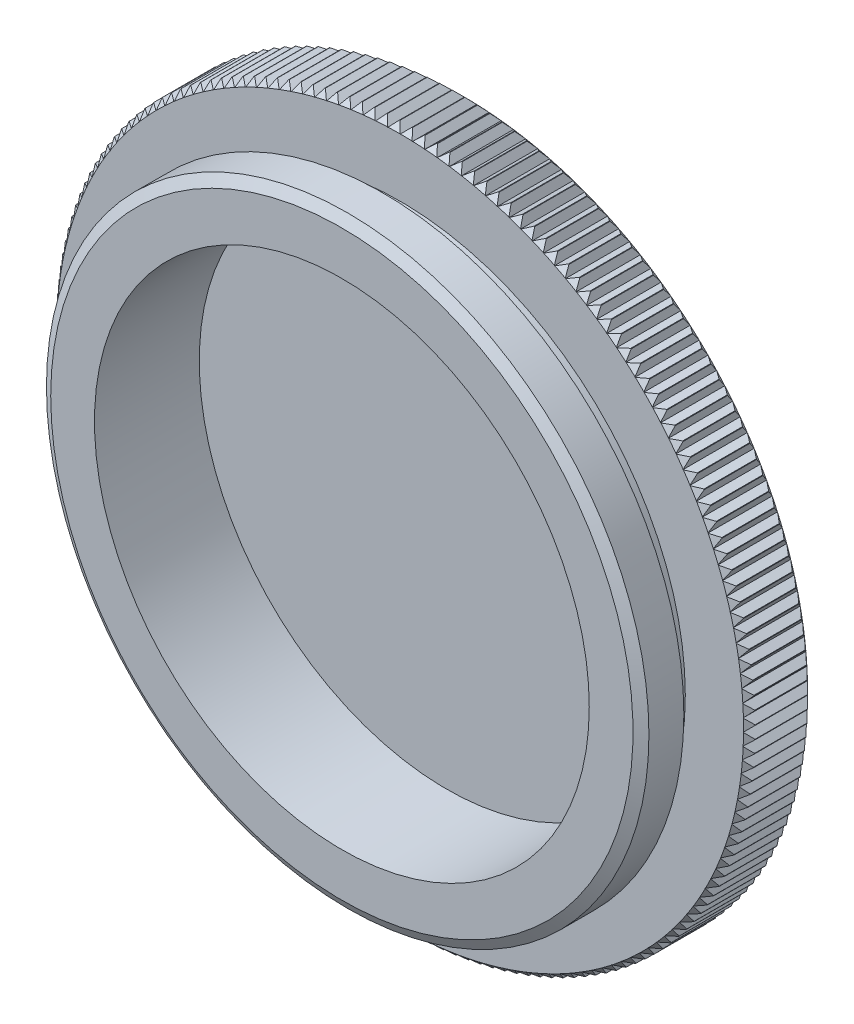
from build123d import *

# Parameters (mm, degrees)
SKETCH2_R          = 10.795
CUT_EXTRUDE1_DEPTH = 4.572
CHAMFER1_SIZE      = 0.254
CHAMFER1_SIZE2     = 0.439940905
CHAMFER2_SIZE      = 0.254
CUT_EXTRUDE2_REACH = 24.203
CIRPATTERN2_COUNT  = 175
CUT_EXTRUDE3_DEPTH = 0.0254
CUT_EXTRUDE4_DEPTH = 0.0254
CUT_EXTRUDE5_DEPTH = 0.0254
CIRPATTERN3_COUNT  = 4


with BuildPart() as part:
    # Sketch1 → Revolve1 (revolve)
    with BuildSketch(Plane(origin=(0, 0, 0), x_dir=(0, 0, -1), z_dir=(1, 0, 0))):
        Polygon((1.393778166, 0), (1.393778166, 15.24), (-1.400221834, 15.24), (-1.400221834, 12.446), (-2.162221834, 12.446), (-2.162221834, 13.1445), (-3.940221834, 13.1445), (-3.940221834, 0), align=None)
    revolve(axis=Axis((0, 0, 0), (0, 0, -1)))

    # Sketch2 → Cut-Extrude1 (cut)
    with BuildSketch(Plane.XY.offset(3.940221834)):
        Circle(SKETCH2_R)
    extrude(amount=-CUT_EXTRUDE1_DEPTH, mode=Mode.SUBTRACT)

    # Chamfer1
    chamfer1_edges = [part.edges().sort_by_distance(p)[0] for p in [
        (0, -13.1445, 3.940221834),
    ]]
    chamfer1_side = [part.faces().sort_by_distance(p)[0] for p in [
        (0, -13.1445, 3.051221834),
    ]]
    chamfer(chamfer1_edges, length=CHAMFER1_SIZE, length2=CHAMFER1_SIZE2, reference=chamfer1_side[0])

    # Chamfer2
    chamfer2_edges = [part.edges().sort_by_distance(p)[0] for p in [
        (0, -15.24, -1.393778166),
        (0, -15.24, 1.400221834),
    ]]
    chamfer(chamfer2_edges, length=CHAMFER2_SIZE)

    # Sketch3 → Cut-Extrude2 (cut, up to next)
    with BuildSketch(Plane(origin=(0, 0, -1.393778166), x_dir=(-1, 0, 0), z_dir=(0, 0, -1)), mode=Mode.PRIVATE) as cut_extrude2_sk1:
        Polygon((0, 14.9754082), (0.262333791, 15.237741991), (0.262333791, 15.352349649), (-0.262333791, 15.352349649), (-0.262333791, 15.237741991), align=None)
    cut_extrude2_tool1 = extrude(cut_extrude2_sk1.sketch, amount=-CUT_EXTRUDE2_REACH, mode=Mode.PRIVATE) & part.part
    cut_extrude2 = cut_extrude2_tool1.solids().sort_by_distance((0, 15.217795, -1.393778))[0]
    add(cut_extrude2, mode=Mode.SUBTRACT)

    # CirPattern2: Cut-Extrude2 ×175 about axis
    cirpattern2_axis = Axis((0, 0, 0), (0, 0, 1))
    for i in range(1, CIRPATTERN2_COUNT):
        add(cut_extrude2.rotate(cirpattern2_axis, i * 360 / CIRPATTERN2_COUNT), mode=Mode.SUBTRACT)

    # Sketch6 → Cut-Extrude3 (cut)
    # profile 1 of 6: a face of its own
    with BuildSketch(Plane(origin=(0, 0, -1.393778166), x_dir=(-1, 0, 0), z_dir=(0, 0, -1))):
        with BuildLine():
            Line((-5.425242444, -10.039358742), (-4.036280419, -10.672801384))
            Line((-4.036280419, -10.672801384), (-4.165591337, -10.95674284))
            add(Edge.make_bspline(
                [(-4.165591337, -10.95674284), (-4.232191946, -10.976236448), (-4.36567092, -11.015304963), (-4.564922799, -11.072620829), (-4.759755235, -11.131036019), (-4.88571104, -11.175820614), (-4.947334612, -11.197731368)],
                knots=[0, 0, 0, 0, 1.017738134, 2.039720695, 3.040938103, 4, 4, 4, 4], degree=3))
            add(Edge.make_bspline(
                [(-4.947334612, -11.197731368), (-4.977830028, -11.208746265), (-5.036913919, -11.230087273), (-5.121611793, -11.263230337), (-5.199955211, -11.294745642), (-5.271588448, -11.325274682), (-5.336157968, -11.355834587), (-5.394588197, -11.384462266), (-5.446237185, -11.412422199), (-5.491836119, -11.439979976), (-5.532955208, -11.467753435), (-5.570170089, -11.497999958), (-5.605111543, -11.52997129), (-5.637124262, -11.564435421), (-5.666763536, -11.600709247), (-5.693451524, -11.639291504), (-5.71751191, -11.679935178), (-5.731236872, -11.708389915), (-5.738120609, -11.722661352)],
                knots=[0, 0, 0, 0, 1.592887712, 3.086168888, 4.4680128, 5.741651633, 6.910933722, 7.977189631, 8.938048339, 9.795198854, 10.594116998, 11.373513348, 12.149031202, 12.919121943, 13.682347591, 14.448476952, 15.22183562, 16, 16, 16, 16], degree=3))
            add(Edge.make_bspline(
                [(-5.738120609, -11.722661352), (-5.743826863, -11.735819401), (-5.75492521, -11.761411076), (-5.76650659, -11.800600604), (-5.774595841, -11.838830739), (-5.777636836, -11.876633744), (-5.776818881, -11.913777521), (-5.771803627, -11.95018178), (-5.762719795, -11.985891737), (-5.749089275, -12.020598656), (-5.73133571, -12.054256421), (-5.709561712, -12.086322006), (-5.684076232, -12.11672224), (-5.654949122, -12.145452608), (-5.621586356, -12.172113086), (-5.584565864, -12.197365882), (-5.543665966, -12.220915888), (-5.514706241, -12.234959106), (-5.499844897, -12.242165704)],
                knots=[0, 0, 0, 0, 1.061588905, 2.064731641, 3.021634949, 3.951648557, 4.867479151, 5.769111024, 6.66818134, 7.590860501, 8.524820106, 9.481723414, 10.456695271, 11.459402951, 12.507400122, 13.616091355, 14.776642925, 16, 16, 16, 16], degree=3))
            add(Edge.make_bspline(
                [(-5.499844897, -12.242165704), (-5.478593151, -12.251307508), (-5.435124759, -12.270006184), (-5.36538503, -12.291034228), (-5.29123057, -12.309394166), (-5.212517736, -12.322782824), (-5.130334442, -12.33096062), (-5.045886698, -12.333019418), (-4.959564504, -12.329771645), (-4.901929254, -12.322340964), (-4.87273216, -12.3185767)],
                knots=[0, 0, 0, 0, 0.866926765, 1.77321487, 2.727288421, 3.730788597, 4.764442105, 5.821714027, 6.89651521, 8, 8, 8, 8], degree=3))
            Line((-4.87273216, -12.3185767), (-4.859168077, -12.324454469))
            Line((-4.859168077, -12.324454469), (-4.987122587, -12.605230973))
            add(Edge.make_bspline(
                [(-4.987122587, -12.605230973), (-5.008082524, -12.605043439), (-5.052792122, -12.604643411), (-5.123574194, -12.598270577), (-5.202115904, -12.587613334), (-5.286586956, -12.573300921), (-5.373213304, -12.553669686), (-5.458296088, -12.529888635), (-5.539882701, -12.5015493), (-5.592058243, -12.478952734), (-5.617852413, -12.467781606)],
                knots=[0, 0, 0, 0, 0.773842009, 1.650680822, 2.622056144, 3.700895976, 4.813535669, 5.900713834, 6.962169978, 8, 8, 8, 8], degree=3))
            add(Edge.make_bspline(
                [(-5.617852413, -12.467781606), (-5.643028605, -12.45573479), (-5.692205257, -12.432203746), (-5.76151723, -12.392553339), (-5.824144756, -12.34943173), (-5.880475661, -12.303709012), (-5.930575951, -12.255394394), (-5.973697483, -12.203782368), (-6.011306468, -12.149964079), (-6.041461712, -12.092890887), (-6.064907304, -12.034177969), (-6.082073986, -11.974403298), (-6.09154921, -11.913652993), (-6.093683161, -11.852062168), (-6.089199107, -11.789719297), (-6.077255836, -11.726668934), (-6.058046155, -11.662813663), (-6.040537909, -11.621085246), (-6.031556922, -11.59968034)],
                knots=[0, 0, 0, 0, 1.232694487, 2.407821973, 3.523267887, 4.588047798, 5.60974283, 6.59262967, 7.554800723, 8.504918084, 9.437114425, 10.343416046, 11.246459297, 12.145887458, 13.060441743, 14.001935556, 14.975077813, 16, 16, 16, 16], degree=3))
            add(Edge.make_bspline(
                [(-6.031556922, -11.59968034), (-6.02245499, -11.580719016), (-6.004525481, -11.543367909), (-5.973850275, -11.490253695), (-5.939477828, -11.441484192), (-5.903584564, -11.395298881), (-5.863575505, -11.353356507), (-5.821929725, -11.31323253), (-5.776183224, -11.276960417), (-5.743983462, -11.254960141), (-5.727721479, -11.243849248)],
                knots=[0, 0, 0, 0, 1.06380074, 2.095535857, 3.098010515, 4.080336405, 5.051264601, 6.027417132, 7.003778056, 8, 8, 8, 8], degree=3))
            add(Edge.make_bspline(
                [(-5.727721479, -11.243849248), (-5.695792847, -11.223983038), (-5.630594286, -11.183416053), (-5.542524327, -11.140972091), (-5.466844771, -11.108231981), (-5.404407639, -11.083205229), (-5.337586712, -11.056616761), (-5.29101215, -11.039943351), (-5.266994818, -11.031345292)],
                knots=[0, 0, 0, 0, 1.330236432, 2.716355056, 3.454655655, 4.249137999, 5.09712445, 6, 6, 6, 6], degree=3))
            add(Edge.make_bspline(
                [(-5.266994818, -11.031345292), (-5.195574938, -11.006271373), (-5.052719604, -10.956118068), (-4.872103984, -10.90119167), (-4.728838735, -10.859860919), (-4.624981332, -10.830075516), (-4.524807915, -10.801413224), (-4.459187876, -10.783088941), (-4.426925989, -10.774079865)],
                knots=[0, 0, 0, 0, 1.550264238, 3.100866531, 3.865829164, 4.604496434, 5.313905015, 6, 6, 6, 6], degree=3))
            Line((-4.426925989, -10.774079865), (-5.53059015, -10.270852413))
            Line((-5.53059015, -10.270852413), (-5.425242444, -10.039358742))
        make_face()
    # profile 2 of 6: a face of its own
    with BuildSketch(Plane(origin=(0, 0, -1.393778166), x_dir=(-1, 0, 0), z_dir=(0, 0, -1))):
        with BuildLine():
            add(Edge.make_bspline(
                [(-4.370808887, -12.254548448), (-4.363448548, -12.230565594), (-4.348935502, -12.183276437), (-4.319160875, -12.1160791), (-4.283795917, -12.053442039), (-4.243059217, -11.995424138), (-4.197471252, -11.94270888), (-4.147971805, -11.895279688), (-4.09442453, -11.853766963), (-4.055915652, -11.830675618), (-4.036680327, -11.819141407)],
                knots=[0, 0, 0, 0, 1.06803962, 2.105950047, 3.12378519, 4.12849274, 5.120937985, 6.08828592, 7.045091874, 8, 8, 8, 8], degree=3))
            add(Edge.make_bspline(
                [(-4.036680327, -11.819141407), (-4.011750512, -11.806417896), (-3.962091416, -11.78107322), (-3.883198959, -11.752217478), (-3.800931448, -11.733742539), (-3.714829313, -11.722265649), (-3.622917983, -11.721318831), (-3.523707929, -11.730513278), (-3.416280426, -11.748992758), (-3.342961697, -11.768640525), (-3.30467202, -11.778901296)],
                knots=[0, 0, 0, 0, 0.890553357, 1.773943134, 2.665465361, 3.570061211, 4.534577923, 5.584519364, 6.738549137, 8, 8, 8, 8], degree=3))
            Line((-3.30467202, -11.778901296), (-3.009427163, -11.86254647))
            Line((-3.009427163, -11.86254647), (-2.780194172, -11.052318622))
            Line((-2.780194172, -11.052318622), (-2.490827083, -11.134155252))
            Line((-2.490827083, -11.134155252), (-3.11341846, -13.333345125))
            Line((-3.11341846, -13.333345125), (-3.713403033, -13.163341961))
            add(Edge.make_bspline(
                [(-3.713403033, -13.163341961), (-3.745309003, -13.153872059), (-3.806562554, -13.135691603), (-3.893133657, -13.10429712), (-3.971179595, -13.071721245), (-4.040674363, -13.036133195), (-4.10326092, -12.997752731), (-4.15960695, -12.955588792), (-4.211414523, -12.910543602), (-4.241518778, -12.877008515), (-4.25641846, -12.86041079)],
                knots=[0, 0, 0, 0, 1.265266304, 2.429076906, 3.499871165, 4.478943139, 5.395005205, 6.287864705, 7.152602476, 8, 8, 8, 8], degree=3))
            add(Edge.make_bspline(
                [(-4.25641846, -12.86041079), (-4.272396475, -12.84009175), (-4.303882201, -12.800051749), (-4.342818231, -12.734833466), (-4.372064269, -12.665927823), (-4.394043987, -12.593801712), (-4.405571543, -12.516441112), (-4.404847173, -12.433716022), (-4.393965812, -12.34522989), (-4.378739521, -12.28560444), (-4.370808887, -12.254548448)],
                knots=[0, 0, 0, 0, 0.961022529, 1.893757851, 2.815508266, 3.739762077, 4.692092892, 5.712547857, 6.808577601, 8, 8, 8, 8], degree=3))
        make_face()
        with BuildLine():
            add(Edge.make_bspline(
                [(-4.079181118, -12.329150901), (-4.084036698, -12.347444057), (-4.093454943, -12.382926832), (-4.099232715, -12.436445719), (-4.100851996, -12.487555562), (-4.094798335, -12.536567451), (-4.082429156, -12.583033881), (-4.064292971, -12.627487392), (-4.039205145, -12.669512803), (-4.018053877, -12.69474825), (-4.007291482, -12.707588796)],
                knots=[0, 0, 0, 0, 1.123772775, 2.179753816, 3.192567675, 4.158504816, 5.104065234, 6.044345053, 7.004904602, 8, 8, 8, 8], degree=3))
            add(Edge.make_bspline(
                [(-4.007291482, -12.707588796), (-3.996764126, -12.718320293), (-3.975516332, -12.739980113), (-3.940043078, -12.769494715), (-3.900905422, -12.796006298), (-3.858188509, -12.821029714), (-3.809738537, -12.843642009), (-3.755239133, -12.865614348), (-3.693786673, -12.886916472), (-3.650311694, -12.89977884), (-3.627497178, -12.90652867)],
                knots=[0, 0, 0, 0, 0.83025547, 1.675738661, 2.544201566, 3.439709683, 4.408133241, 5.495201935, 6.685548445, 8, 8, 8, 8], degree=3))
            Line((-3.627497178, -12.90652867), (-3.329087368, -12.991078116))
            Line((-3.329087368, -12.991078116), (-3.083125343, -12.12297685))
            Line((-3.083125343, -12.12297685), (-3.337677954, -12.050635078))
            add(Edge.make_bspline(
                [(-3.337677954, -12.050635078), (-3.36683879, -12.042785746), (-3.422290693, -12.027859549), (-3.502591221, -12.011421801), (-3.575521404, -12.001159914), (-3.641638776, -11.99709054), (-3.702096594, -11.999820428), (-3.757851176, -12.008101288), (-3.809796719, -12.02293314), (-3.841527578, -12.037850045), (-3.857182305, -12.045209445)],
                knots=[0, 0, 0, 0, 1.362124689, 2.590200228, 3.695023736, 4.682388931, 5.574001468, 6.420206356, 7.220593491, 8, 8, 8, 8], degree=3))
            add(Edge.make_bspline(
                [(-3.857182305, -12.045209445), (-3.871826193, -12.053673533), (-3.90028374, -12.070121841), (-3.938867825, -12.098676886), (-3.972397547, -12.129769335), (-4.001076164, -12.163560821), (-4.025837531, -12.200094597), (-4.046434428, -12.24012585), (-4.065493197, -12.282885324), (-4.074551597, -12.313502984), (-4.079181118, -12.329150901)],
                knots=[0, 0, 0, 0, 1.092289841, 2.12265277, 3.094223843, 4.04067576, 4.980642125, 5.939043408, 6.946696852, 8, 8, 8, 8], degree=3))
        make_face(mode=Mode.SUBTRACT)
    # profile 3 of 6: a face of its own
    with BuildSketch(Plane(origin=(0, 0, -1.393778166), x_dir=(-1, 0, 0), z_dir=(0, 0, -1))):
        with BuildLine():
            add(Edge.make_bspline(
                [(-2.324092495, -11.329993519), (-2.296176793, -11.321660783), (-2.242956791, -11.305774805), (-2.177359132, -11.284606898), (-2.124995928, -11.268058021), (-2.081103155, -11.25719253), (-2.032202481, -11.245619184), (-1.997679134, -11.238980423), (-1.979564805, -11.235497079)],
                knots=[0, 0, 0, 0, 1.466561919, 2.795932913, 3.470355627, 4.230381201, 5.071484681, 6, 6, 6, 6], degree=3))
            add(Edge.make_bspline(
                [(-1.979564805, -11.235497079), (-1.946307553, -11.230156045), (-1.877476513, -11.219101948), (-1.78905805, -11.211044569), (-1.714335103, -11.207838357), (-1.65504583, -11.208468975), (-1.593314388, -11.211425762), (-1.55152427, -11.215983734), (-1.530141546, -11.218315908)],
                knots=[0, 0, 0, 0, 1.342800985, 2.779134778, 3.536914688, 4.324168581, 5.14252838, 6, 6, 6, 6], degree=3))
            add(Edge.make_bspline(
                [(-1.530141546, -11.218315908), (-1.489937103, -11.223838388), (-1.411216246, -11.23465148), (-1.297359082, -11.261669463), (-1.190188046, -11.296361986), (-1.089672714, -11.339346625), (-0.996177356, -11.390892649), (-0.910022376, -11.451246801), (-0.831832968, -11.521173082), (-0.786832262, -11.574488475), (-0.764223033, -11.601275165)],
                knots=[0, 0, 0, 0, 1.107115004, 2.167746567, 3.188899937, 4.178419171, 5.146903913, 6.097560798, 7.044177573, 8, 8, 8, 8], degree=3))
            add(Edge.make_bspline(
                [(-0.764223033, -11.601275165), (-0.743668705, -11.629629877), (-0.702002515, -11.68710842), (-0.65079115, -11.783029826), (-0.61011659, -11.888184774), (-0.583261042, -11.981487936), (-0.566365807, -12.060020407), (-0.557198199, -12.121833181), (-0.549705969, -12.18543142), (-0.54571854, -12.251239129), (-0.544963147, -12.318976165), (-0.546805022, -12.388651141), (-0.551269324, -12.460296778), (-0.556363124, -12.508577502), (-0.558953255, -12.533127617)],
                knots=[0, 0, 0, 0, 1.286889081, 2.608684938, 3.98483233, 5.426846736, 6.174771155, 6.937521092, 7.724066818, 8.529314638, 9.360803527, 10.214677469, 11.092186878, 12, 12, 12, 12], degree=3))
            add(Edge.make_bspline(
                [(-0.558953255, -12.533127617), (-0.565098545, -12.578932586), (-0.577114371, -12.668494587), (-0.607947653, -12.797357423), (-0.646391325, -12.918075947), (-0.694907361, -13.029383112), (-0.751471299, -13.131653301), (-0.815960754, -13.224507528), (-0.88809558, -13.308082896), (-0.942834257, -13.355862376), (-0.969944948, -13.379526351)],
                knots=[0, 0, 0, 0, 1.149088359, 2.246801099, 3.291406915, 4.297234375, 5.262297596, 6.194235069, 7.105650009, 8, 8, 8, 8], degree=3))
            add(Edge.make_bspline(
                [(-0.969944948, -13.379526351), (-0.9976768, -13.40054257), (-1.053193371, -13.442615072), (-1.145055016, -13.493889139), (-1.242784768, -13.536386424), (-1.346860208, -13.568282635), (-1.456422332, -13.58983335), (-1.570516768, -13.6016055), (-1.689231132, -13.602629386), (-1.769212264, -13.595011975), (-1.810013777, -13.591126035)],
                knots=[0, 0, 0, 0, 0.937282879, 1.876352493, 2.828321192, 3.806531764, 4.805160123, 5.834690619, 6.895390737, 8, 8, 8, 8], degree=3))
            add(Edge.make_bspline(
                [(-1.810013777, -13.591126035), (-1.840358393, -13.586928156), (-1.901186902, -13.578513132), (-1.99172583, -13.559994646), (-2.081437769, -13.535261098), (-2.171495511, -13.505398546), (-2.262956588, -13.46762977), (-2.357607823, -13.421737702), (-2.456203104, -13.366889735), (-2.522021356, -13.325441421), (-2.556038302, -13.304019627)],
                knots=[0, 0, 0, 0, 0.91097673, 1.826134698, 2.746099436, 3.677406448, 4.646346722, 5.68686294, 6.804497877, 8, 8, 8, 8], degree=3))
            Line((-2.556038302, -13.304019627), (-2.514893919, -12.950901351))
            Line((-2.514893919, -12.950901351), (-2.492287115, -12.953614168))
            add(Edge.make_bspline(
                [(-2.492287115, -12.953614168), (-2.464337306, -12.981155731), (-2.40985146, -13.034845734), (-2.323919003, -13.106344292), (-2.237096593, -13.16739658), (-2.149125649, -13.218876201), (-2.057981991, -13.260353946), (-1.96328, -13.2934408), (-1.86422492, -13.318046465), (-1.796402119, -13.327947124), (-1.762087353, -13.332956336)],
                knots=[0, 0, 0, 0, 1.120292354, 2.183917457, 3.188170243, 4.148632051, 5.090482817, 6.043363022, 7.010044712, 8, 8, 8, 8], degree=3))
            add(Edge.make_bspline(
                [(-1.762087353, -13.332956336), (-1.734081835, -13.335623966), (-1.67934714, -13.340837649), (-1.598326007, -13.339105528), (-1.520753163, -13.330832621), (-1.446335902, -13.314620136), (-1.375259389, -13.289668174), (-1.30664145, -13.25784152), (-1.241321862, -13.216555011), (-1.20111178, -13.183732645), (-1.180640359, -13.167022396)],
                knots=[0, 0, 0, 0, 1.081566162, 2.113840354, 3.111480509, 4.079408207, 5.036630015, 6.004158163, 6.983893662, 8, 8, 8, 8], degree=3))
            add(Edge.make_bspline(
                [(-1.180640359, -13.167022396), (-1.161353584, -13.148911919), (-1.121970769, -13.111931056), (-1.070237886, -13.047117584), (-1.023646036, -12.974135395), (-0.981548486, -12.893433768), (-0.944821655, -12.804748955), (-0.915381082, -12.70790752), (-0.891488953, -12.603688525), (-0.88179246, -12.531119037), (-0.876804916, -12.493791779)],
                knots=[0, 0, 0, 0, 0.840166655, 1.715586408, 2.627225418, 3.589380103, 4.605417933, 5.673739588, 6.803451356, 8, 8, 8, 8], degree=3))
            add(Edge.make_bspline(
                [(-0.876804916, -12.493791779), (-0.873064217, -12.454795584), (-0.865839661, -12.379480732), (-0.864706056, -12.269659396), (-0.87302096, -12.16728496), (-0.890800368, -12.07245279), (-0.915774884, -11.985168179), (-0.945934097, -11.905138524), (-0.98168271, -11.832387484), (-1.011469614, -11.78919661), (-1.026009821, -11.768113377)],
                knots=[0, 0, 0, 0, 1.239588764, 2.394065482, 3.471226065, 4.485449888, 5.442792445, 6.341161873, 7.190253235, 8, 8, 8, 8], degree=3))
            add(Edge.make_bspline(
                [(-1.026009821, -11.768113377), (-1.041808299, -11.747800837), (-1.073198051, -11.707442166), (-1.128428919, -11.654676623), (-1.188688364, -11.608534692), (-1.253834558, -11.569298147), (-1.323037244, -11.536881474), (-1.395373402, -11.510934643), (-1.470516525, -11.491822288), (-1.521920296, -11.484325495), (-1.547774853, -11.480554832)],
                knots=[0, 0, 0, 0, 1.006335288, 1.999472051, 2.98017372, 3.972872185, 4.970608164, 5.967244362, 6.977584843, 8, 8, 8, 8], degree=3))
            add(Edge.make_bspline(
                [(-1.547774853, -11.480554832), (-1.583459133, -11.477173193), (-1.65412758, -11.47047626), (-1.759668676, -11.472216995), (-1.862894082, -11.482951484), (-1.963742287, -11.503376872), (-2.062195697, -11.533474131), (-2.158786018, -11.572667486), (-2.253422074, -11.621372196), (-2.313563521, -11.660570333), (-2.343986482, -11.680398978)],
                knots=[0, 0, 0, 0, 1.023852063, 2.027616506, 3.010901906, 3.98664765, 4.963685698, 5.949185973, 6.962581741, 8, 8, 8, 8], degree=3))
            Line((-2.343986482, -11.680398978), (-2.365236878, -11.677686162))
            Line((-2.365236878, -11.677686162), (-2.324092495, -11.329993519))
        make_face()
    # profile 4 of 6: a face of its own
    with BuildSketch(Plane(origin=(0, 0, -1.393778166), x_dir=(-1, 0, 0), z_dir=(0, 0, -1))):
        with BuildLine():
            Line((-0.124355339, -11.402859405), (1.090986433, -11.347698803))
            Line((1.090986433, -11.347698803), (1.101385563, -11.579192474))
            Line((1.101385563, -11.579192474), (0.638398221, -11.599990734))
            Line((0.638398221, -11.599990734), (0.708479313, -13.133636303))
            Line((0.708479313, -13.133636303), (1.171466655, -13.112838044))
            Line((1.171466655, -13.112838044), (1.180509376, -13.315395006))
            add(Edge.make_bspline(
                [(1.180509376, -13.315395006), (1.148044128, -13.317554021), (1.080500515, -13.32204583), (0.996847623, -13.336690372), (0.930985947, -13.350941413), (0.8873902, -13.363725843), (0.84986344, -13.377009181), (0.828322395, -13.388977297), (0.818348379, -13.394518819)],
                knots=[0, 0, 0, 0, 1.567385824, 3.260930031, 4.087516969, 4.813992074, 5.450850168, 6, 6, 6, 6], degree=3))
            add(Edge.make_bspline(
                [(0.818348379, -13.394518819), (0.807581406, -13.401465975), (0.786479856, -13.415081292), (0.758937297, -13.440140646), (0.734078297, -13.466625347), (0.713609894, -13.496490643), (0.696424857, -13.529776279), (0.686022532, -13.568295715), (0.677694327, -13.61104409), (0.676830385, -13.641335959), (0.676377652, -13.657209879)],
                knots=[0, 0, 0, 0, 0.97809446, 1.916909106, 2.838593263, 3.749625943, 4.677270178, 5.687227052, 6.788032028, 8, 8, 8, 8], degree=3))
            Line((0.676377652, -13.657209879), (0.4426233, -13.667609009))
            Line((0.4426233, -13.667609009), (0.349031133, -11.61310268))
            Line((0.349031133, -11.61310268), (-0.113956209, -11.634353075))
            Line((-0.113956209, -11.634353075), (-0.124355339, -11.402859405))
        make_face()
    # profile 5 of 6: a face of its own
    with BuildSketch(Plane(origin=(0, 0, -1.393778166), x_dir=(-1, 0, 0), z_dir=(0, 0, -1))):
        Polygon((1.613452157, -11.284171711), (1.902819246, -11.2163513), (2.347269009, -13.11170573), (2.667833487, -11.677982234), (2.845070828, -11.636385715), (3.765167743, -12.778933579), (3.32071798, -10.883579148), (3.58114836, -10.822540778), (4.097035623, -13.021730651), (3.708650733, -13.113062139), (2.825176841, -12.030196237), (2.534453344, -13.388413009), (2.12933942, -13.483361585), align=None)
    # profile 6 of 6: a face of its own
    with BuildSketch(Plane(origin=(0, 0, -1.393778166), x_dir=(-1, 0, 0), z_dir=(0, 0, -1))):
        with BuildLine():
            add(Edge.make_bspline(
                [(4.089161807, -11.341312106), (4.080649637, -11.320390194), (4.063517907, -11.278282414), (4.047279458, -11.211468492), (4.037629147, -11.142089637), (4.035506279, -11.0707101), (4.040617168, -10.998620678), (4.054624876, -10.927971049), (4.074871928, -10.858896127), (4.09521643, -10.815553304), (4.105438706, -10.793775318)],
                knots=[0, 0, 0, 0, 0.957770038, 1.927623502, 2.909369989, 3.927168381, 4.953737089, 5.970126819, 6.980072194, 8, 8, 8, 8], degree=3))
            add(Edge.make_bspline(
                [(4.105438706, -10.793775318), (4.118072581, -10.770275366), (4.143527334, -10.722927621), (4.190940805, -10.656511145), (4.244302028, -10.592578448), (4.305093269, -10.531257446), (4.37476273, -10.472930291), (4.455034994, -10.418466106), (4.545106098, -10.366157778), (4.610214903, -10.335706501), (4.643932772, -10.31993671)],
                knots=[0, 0, 0, 0, 0.874103042, 1.761144341, 2.669770053, 3.602796301, 4.58861691, 5.644116119, 6.779959405, 8, 8, 8, 8], degree=3))
            add(Edge.make_bspline(
                [(4.643932772, -10.31993671), (4.681019165, -10.304074518), (4.753482805, -10.273081151), (4.861921813, -10.233383704), (4.967515442, -10.202821411), (5.070580525, -10.178803585), (5.173731208, -10.161427161), (5.278834085, -10.150148377), (5.38697883, -10.142440909), (5.460024448, -10.141712707), (5.497113547, -10.14134296)],
                knots=[0, 0, 0, 0, 1.101428906, 2.15209787, 3.151064416, 4.101509646, 5.040659714, 6.005573456, 6.987324809, 8, 8, 8, 8], degree=3))
            Line((5.497113547, -10.14134296), (5.654456902, -10.493104828))
            Line((5.654456902, -10.493104828), (5.634562914, -10.501695413))
            add(Edge.make_bspline(
                [(5.634562914, -10.501695413), (5.597358532, -10.491430488), (5.522789867, -10.47085652), (5.407374523, -10.453850203), (5.289498534, -10.446857135), (5.170782129, -10.451368989), (5.054448724, -10.464314839), (4.943646233, -10.484788421), (4.840086404, -10.513705512), (4.775433979, -10.540265728), (4.743854845, -10.553238926)],
                knots=[0, 0, 0, 0, 1.017500239, 2.039373576, 3.071018606, 4.129378757, 5.169685882, 6.15704919, 7.099820438, 8, 8, 8, 8], degree=3))
            add(Edge.make_bspline(
                [(4.743854845, -10.553238926), (4.722949508, -10.562968296), (4.682291836, -10.581890428), (4.624678221, -10.613136957), (4.572034399, -10.646093063), (4.524491525, -10.680928714), (4.481837811, -10.717146298), (4.443889724, -10.754580396), (4.411648623, -10.794367678), (4.384092091, -10.835152421), (4.361904384, -10.876850502), (4.344639416, -10.918688938), (4.334071988, -10.961064245), (4.32768009, -11.003349262), (4.328087298, -11.045763848), (4.332814257, -11.088192894), (4.343907356, -11.1307091), (4.355145036, -11.158163985), (4.360895589, -11.172213214)],
                knots=[0, 0, 0, 0, 1.356623665, 2.638424883, 3.853930751, 5.00867963, 6.103359021, 7.144344209, 8.140228778, 9.111808118, 10.036221716, 10.915637953, 11.767432091, 12.60022402, 13.424996969, 14.25551919, 15.107313328, 16, 16, 16, 16], degree=3))
            add(Edge.make_bspline(
                [(4.360895589, -11.172213214), (4.366142224, -11.183457706), (4.376331507, -11.20529519), (4.394100244, -11.235551399), (4.412622258, -11.262786356), (4.431923921, -11.287036983), (4.452963521, -11.307580259), (4.475158653, -11.324802863), (4.498337221, -11.338977497), (4.531361036, -11.353938957), (4.577837676, -11.365074305), (4.639095175, -11.371351957), (4.707538191, -11.36902576), (4.755059507, -11.362417295), (4.780025731, -11.358945413)],
                knots=[0, 0, 0, 0, 0.881744882, 1.712401842, 2.491052324, 3.222333197, 3.91183767, 4.576242292, 5.215728865, 5.839124574, 7.146375302, 8.589974772, 10.208478648, 12, 12, 12, 12], degree=3))
            add(Edge.make_bspline(
                [(4.780025731, -11.358945413), (4.821130506, -11.351464861), (4.906125421, -11.335996855), (5.035719495, -11.301921714), (5.173507688, -11.263911005), (5.269437821, -11.242200999), (5.318971933, -11.230990903)],
                knots=[0, 0, 0, 0, 0.90449889, 1.870288963, 2.900310643, 4, 4, 4, 4], degree=3))
            add(Edge.make_bspline(
                [(5.318971933, -11.230990903), (5.344092355, -11.226032442), (5.393078951, -11.216363091), (5.465412071, -11.20701532), (5.534242819, -11.201686138), (5.59968315, -11.201717934), (5.661798582, -11.206162478), (5.720731653, -11.214926026), (5.776241381, -11.22910377), (5.828477846, -11.247667445), (5.877765965, -11.270658265), (5.92340903, -11.299170504), (5.966827391, -11.33101688), (6.006347825, -11.368712771), (6.042926895, -11.410935421), (6.07698217, -11.457474271), (6.107346187, -11.508989391), (6.124801163, -11.54553789), (6.133721142, -11.564215191)],
                knots=[0, 0, 0, 0, 1.269933125, 2.476459365, 3.615884523, 4.692524335, 5.719552574, 6.702954364, 7.644094001, 8.556921051, 9.449905367, 10.335976962, 11.222710734, 12.116571015, 13.038659397, 13.991281631, 14.97348897, 16, 16, 16, 16], degree=3))
            add(Edge.make_bspline(
                [(6.133721142, -11.564215191), (6.142879417, -11.586324766), (6.160861247, -11.629735847), (6.177752711, -11.697317398), (6.187234385, -11.764645608), (6.187437735, -11.832249479), (6.179859934, -11.900000934), (6.163183713, -11.967742259), (6.138496614, -12.035646992), (6.105649262, -12.102865064), (6.065253334, -12.16810511), (6.019305503, -12.230842721), (5.966211201, -12.289333113), (5.907548045, -12.34456958), (5.842241919, -12.395762795), (5.771273528, -12.443841718), (5.693622456, -12.487650481), (5.638949266, -12.513581427), (5.611051839, -12.526812897)],
                knots=[0, 0, 0, 0, 0.938468665, 1.842637895, 2.726361101, 3.602144099, 4.489544476, 5.396594187, 6.334391024, 7.321519503, 8.328263758, 9.343700289, 10.370265364, 11.425208758, 12.503687581, 13.624624972, 14.787946139, 16, 16, 16, 16], degree=3))
            add(Edge.make_bspline(
                [(5.611051839, -12.526812897), (5.574424601, -12.542545644), (5.502441466, -12.573465052), (5.39413577, -12.612780894), (5.287943875, -12.644509515), (5.18466421, -12.669423124), (5.084602002, -12.687570339), (4.988741601, -12.701896362), (4.896987197, -12.711131292), (4.837162838, -12.713667591), (4.808058168, -12.714901505)],
                knots=[0, 0, 0, 0, 1.152483545, 2.264964148, 3.329349733, 4.355675761, 5.335193232, 6.268881528, 7.157807425, 8, 8, 8, 8], degree=3))
            Line((4.808058168, -12.714901505), (4.664731032, -12.394337027))
            Line((4.664731032, -12.394337027), (4.684625019, -12.385746441))
            add(Edge.make_bspline(
                [(4.684625019, -12.385746441), (4.713445908, -12.392586122), (4.773117316, -12.406747149), (4.868137742, -12.415551783), (4.970328971, -12.417565844), (5.078404567, -12.409925912), (5.189255968, -12.394539487), (5.299282893, -12.369953607), (5.406990607, -12.337311457), (5.476084754, -12.30842513), (5.51067763, -12.293962818)],
                knots=[0, 0, 0, 0, 0.839879268, 1.738904651, 2.701589136, 3.739106435, 4.810544369, 5.875437592, 6.936310435, 8, 8, 8, 8], degree=3))
            add(Edge.make_bspline(
                [(5.51067763, -12.293962818), (5.529024486, -12.285442981), (5.56487497, -12.268794881), (5.615481311, -12.240720595), (5.662055427, -12.210908488), (5.703777835, -12.178624779), (5.742413048, -12.145696534), (5.776273421, -12.110249627), (5.806354214, -12.073231502), (5.831652969, -12.034336807), (5.852148866, -11.99467447), (5.8691866, -11.955364724), (5.87921434, -11.915487563), (5.885620995, -11.876118254), (5.885651119, -11.83675292), (5.881997453, -11.79745021), (5.871713035, -11.758503625), (5.861650537, -11.733366585), (5.856561728, -11.720654274)],
                knots=[0, 0, 0, 0, 1.299943114, 2.54014036, 3.717125457, 4.850646297, 5.928787865, 6.977092939, 7.996852217, 8.991073854, 9.953054296, 10.86520617, 11.737005782, 12.589206995, 13.422419145, 14.260124854, 15.120109889, 16, 16, 16, 16], degree=3))
            add(Edge.make_bspline(
                [(5.856561728, -11.720654274), (5.846521015, -11.700080338), (5.827263671, -11.660621053), (5.789093096, -11.609875167), (5.745091836, -11.570108146), (5.703518904, -11.546032277), (5.667293552, -11.532791239), (5.637389165, -11.52563298), (5.604884325, -11.520663093), (5.569484431, -11.51849959), (5.531432372, -11.519178621), (5.490521261, -11.521868981), (5.446884188, -11.527258945), (5.417058195, -11.532852669), (5.401712835, -11.535730619)],
                knots=[0, 0, 0, 0, 1.516199807, 2.90795905, 4.18248161, 5.427565864, 6.06651121, 6.735791933, 7.464013503, 8.245471981, 9.085378405, 9.987211803, 10.964428173, 12, 12, 12, 12], degree=3))
            add(Edge.make_bspline(
                [(5.401712835, -11.535730619), (5.383323811, -11.539788798), (5.34319313, -11.548645031), (5.277770214, -11.563351447), (5.202622478, -11.58275987), (5.119927479, -11.60373133), (5.035469206, -11.624915866), (4.954583278, -11.643998545), (4.879997485, -11.660030523), (4.832195708, -11.668629698), (4.809414576, -11.67272785)],
                knots=[0, 0, 0, 0, 0.74327993, 1.622072452, 2.646411068, 3.80637327, 4.989411942, 6.08311568, 7.086460844, 8, 8, 8, 8], degree=3))
            add(Edge.make_bspline(
                [(4.809414576, -11.67272785), (4.787897389, -11.67603381), (4.745750293, -11.682509406), (4.683489205, -11.687072008), (4.624051222, -11.689150839), (4.567360232, -11.687601446), (4.513495377, -11.681419556), (4.462096434, -11.672836983), (4.413726824, -11.659338037), (4.367527545, -11.643461983), (4.324316568, -11.62224823), (4.283097976, -11.597083666), (4.245222724, -11.565658913), (4.208855877, -11.530595334), (4.175314496, -11.490168791), (4.143557492, -11.445468446), (4.114562951, -11.395420914), (4.097785906, -11.359682921), (4.089161807, -11.341312106)],
                knots=[0, 0, 0, 0, 1.202659278, 2.355725906, 3.447351348, 4.489026367, 5.486090483, 6.441911092, 7.365281458, 8.258365351, 9.137513525, 10.020402018, 10.920565546, 11.851195167, 12.808864805, 13.818753312, 14.878748455, 16, 16, 16, 16], degree=3))
        make_face()
    extrude(amount=-CUT_EXTRUDE3_DEPTH, mode=Mode.SUBTRACT)

    # Sketch7 → Cut-Extrude4 (cut)
    # profile 1 of 6: a face of its own
    with BuildSketch(Plane(origin=(0, 0, -1.393778166), x_dir=(-1, 0, 0), z_dir=(0, 0, -1))):
        with BuildLine():
            Line((-4.502424579, 11.635185787), (-4.124854455, 10.659759648))
            add(Edge.make_bspline(
                [(-3.583809058, 10.853626705), (-3.765744376, 10.793552643), (-3.946168857, 10.728903052), (-4.124854455, 10.659759648)],
                knots=[0, 0, 0, 0, 1, 1, 1, 1], degree=3))
            Line((-3.583809058, 10.853626705), (-4.387161249, 13.263237723))
            add(Edge.make_bspline(
                [(-5.041749515, 13.028494215), (-4.825565787, 13.112210062), (-4.607291097, 13.190529287), (-4.387161249, 13.263237723)],
                knots=[0, 0, 0, 0, 1, 1, 1, 1], degree=3))
            Line((-5.041749515, 13.028494215), (-4.707857851, 12.165908343))
            add(Edge.make_bspline(
                [(-5.507030436, 11.82563754), (-5.244467471, 11.947785039), (-4.977902422, 12.061334612), (-4.707857851, 12.165908343)],
                knots=[0, 0, 0, 0, 1, 1, 1, 1], degree=3))
            Line((-5.507030436, 11.82563754), (-5.899693184, 12.663106343))
            add(Edge.make_bspline(
                [(-8.407355873, 11.156938075), (-7.627199475, 11.744827122), (-6.785194635, 12.250620325), (-5.899693184, 12.663106343)],
                knots=[0, 0, 0, 0, 1, 1, 1, 1], degree=3))
            Line((-8.407355873, 11.156938075), (-8.064808298, 10.702362088))
            add(Edge.make_bspline(
                [(-7.437814647, 11.147221815), (-7.650946984, 11.004879238), (-7.860115365, 10.856594234), (-8.064808298, 10.702362088)],
                knots=[0, 0, 0, 0, 1, 1, 1, 1], degree=3))
            Line((-7.437814647, 11.147221815), (-6.341959285, 9.509177273))
            add(Edge.make_bspline(
                [(-5.855962291, 9.815936309), (-6.020498116, 9.717778014), (-6.182565391, 9.615481906), (-6.341959285, 9.509177273)],
                knots=[0, 0, 0, 0, 1, 1, 1, 1], degree=3))
            Line((-5.855962291, 9.815936309), (-6.872785536, 11.504193809))
            add(Edge.make_bspline(
                [(-6.25664881, 11.850586441), (-6.465003149, 11.740524114), (-6.670560148, 11.625151677), (-6.872785536, 11.504193809)],
                knots=[0, 0, 0, 0, 1, 1, 1, 1], degree=3))
            Line((-6.25664881, 11.850586441), (-5.336181024, 10.107921252))
            add(Edge.make_bspline(
                [(-4.821407703, 10.363345395), (-4.995103184, 10.282535897), (-5.166766598, 10.197358639), (-5.336181024, 10.107921252)],
                knots=[0, 0, 0, 0, 1, 1, 1, 1], degree=3))
            Line((-4.821407703, 10.363345395), (-5.265437127, 11.310368743))
            add(Edge.make_bspline(
                [(-4.502424579, 11.635185787), (-4.760250717, 11.535365522), (-5.014759908, 11.426983755), (-5.265437127, 11.310368743)],
                knots=[0, 0, 0, 0, 1, 1, 1, 1], degree=3))
        make_face()
    # profile 2 of 6: a face of its own
    with BuildSketch(Plane(origin=(0, 0, -1.393778166), x_dir=(-1, 0, 0), z_dir=(0, 0, -1))):
        with BuildLine():
            add(Edge.make_bspline(
                [(2.679041403, 11.496363616), (2.857796012, 11.454739649), (3.035557592, 11.40886059), (3.212175575, 11.358942781)],
                knots=[0, 0, 0, 0, 1, 1, 1, 1], degree=3))
            Line((3.212175575, 11.358942781), (3.231237883, 10.963758558))
            add(Edge.make_bspline(
                [(3.231237883, 10.963758558), (3.755923475, 10.809123273), (4.269485902, 10.616760203), (4.766648685, 10.38864574)],
                knots=[0, 0, 0, 0, 1, 1, 1, 1], degree=3))
            add(Edge.make_bspline(
                [(4.766648685, 10.38864574), (4.792384318, 10.378215627), (4.843344427, 10.357562563), (4.922348787, 10.33558946), (5.00195286, 10.320812784), (5.082473086, 10.313878429), (5.203344023, 10.31464956), (5.366641524, 10.344259063), (5.479780045, 10.419565794), (5.536458118, 10.457291587)],
                knots=[0, 0, 0, 0, 0.102660879, 0.203282722, 0.302721066, 0.401862096, 0.501599917, 0.750320612, 1, 1, 1, 1], degree=3))
            add(Edge.make_bspline(
                [(5.536458118, 10.457291587), (5.533895157, 10.432773742), (5.528722718, 10.383293047), (5.531880692, 10.332312541), (5.535056468, 10.306223511), (5.535202915, 10.305046691)],
                knots=[0, 0, 0, 0, 0.119789263, 0.241752726, 0.247516465, 0.247516465, 0.247516465, 0.247516465], degree=3))
            add(Edge.make_bspline(
                [(5.535202915, 10.305046691), (5.538260392, 10.280477293), (5.54754059, 10.22937272), (5.576418524, 10.132891514), (5.615523293, 10.050624119), (5.649960886, 9.997731026), (5.658125006, 9.985789116)],
                knots=[0.247516465, 0.247516465, 0.247516465, 0.247516465, 0.367850544, 0.499858834, 0.736813316, 0.807257484, 0.807257484, 0.807257484, 0.807257484], degree=3))
            add(Edge.make_bspline(
                [(5.658125006, 9.985789116), (5.680462879, 9.953114815), (5.70483943, 9.921781975), (5.729215982, 9.890449135)],
                knots=[0.807257484, 0.807257484, 0.807257484, 0.807257484, 1, 1, 1, 1], degree=3))
            add(Edge.make_bspline(
                [(5.729215982, 9.890449135), (5.910136842, 9.656145242), (6.14536519, 9.508172542), (6.434901028, 9.446531044)],
                knots=[0, 0, 0, 0, 1, 1, 1, 1], degree=3))
            add(Edge.make_bspline(
                [(6.434901028, 9.446531044), (6.465423713, 9.440735305), (6.49594639, 9.434939567), (6.526700094, 9.430840753)],
                knots=[0, 0, 0, 0, 0.090368691, 0.090368691, 0.090368691, 0.090368691], degree=3))
            add(Edge.make_bspline(
                [(6.526700094, 9.430840753), (6.804233098, 9.398127456), (7.096504309, 9.493713577), (7.292697428, 9.690479838)],
                knots=[0.090441668, 0.090441668, 0.090441668, 0.090441668, 0.904542557, 0.904542557, 0.904542557, 0.904542557], degree=3))
            add(Edge.make_bspline(
                [(7.292697428, 9.690479838), (7.315040514, 9.714229063), (7.336305169, 9.739026999), (7.357569824, 9.763824935)],
                knots=[0.905018665, 0.905018665, 0.905018665, 0.905018665, 1, 1, 1, 1], degree=3))
            add(Edge.make_bspline(
                [(7.357569824, 9.763824935), (7.369316541, 9.785855497), (7.392809974, 9.829916623), (7.43009883, 9.877895944), (7.457622791, 9.922432938), (7.477969283, 9.968052626), (7.505721449, 10.030300088), (7.52906229, 10.112117283), (7.534733757, 10.211947953), (7.528852722, 10.319354159), (7.498203728, 10.43537211), (7.436887894, 10.556675291), (7.347830869, 10.692461952), (7.27340532, 10.783358313), (7.233104999, 10.832577333)],
                knots=[0, 0, 0, 0, 0.062598858, 0.125197716, 0.152223713, 0.193908715, 0.250452958, 0.323478218, 0.406022135, 0.500445971, 0.592729816, 0.705084335, 0.840307577, 1, 1, 1, 1], degree=3))
            add(Edge.make_bspline(
                [(7.233104999, 10.832577333), (7.229793371, 10.836654456), (7.226452656, 10.840707604), (7.223082854, 10.844736778)],
                knots=[0, 0, 0, 0, 1, 1, 1, 1], degree=3))
            add(Edge.make_bspline(
                [(7.223082854, 10.844736778), (7.318401373, 10.780780912), (7.508919705, 10.652948826), (7.694335327, 10.517821821), (7.786985375, 10.450300415)],
                knots=[0, 0, 0, 0, 0.500311532, 1, 1, 1, 1], degree=3))
            add(Edge.make_bspline(
                [(7.786985375, 10.450300415), (7.831156852, 10.511742349), (7.906603395, 10.616687483), (7.982679856, 10.765631945), (8.014620314, 10.884044468), (8.029927222, 10.979873327), (8.024847688, 11.072060404), (8.008107219, 11.156954486), (7.990600664, 11.234909846), (7.971818505, 11.296569729), (7.944750933, 11.351467582), (7.912166599, 11.399800251), (7.882885776, 11.447173142), (7.860546891, 11.48202157), (7.845883643, 11.504780977), (7.831256219, 11.525897882), (7.808564011, 11.549042384), (7.77640857, 11.583190321), (7.735824801, 11.62298193), (7.67396269, 11.683854115), (7.576320445, 11.764060943), (7.489214478, 11.820593369), (7.440402039, 11.852273007)],
                knots=[0, 0, 0, 0, 0.134120354, 0.229082607, 0.294321477, 0.350938228, 0.400338835, 0.457058096, 0.504219786, 0.54204852, 0.570987054, 0.61236684, 0.645287035, 0.669748241, 0.685752016, 0.693305158, 0.715244853, 0.742990211, 0.776562854, 0.815974813, 0.896875972, 1, 1, 1, 1], degree=3))
            add(Edge.make_bspline(
                [(7.440402039, 11.852273007), (7.409436894, 11.871115019), (7.346358187, 11.909497843), (7.243599071, 11.956939315), (7.133239679, 11.998345678), (7.014603109, 12.032285743), (6.896079217, 12.059599486), (6.778434665, 12.073586694), (6.664500399, 12.067139104), (6.550135115, 12.042771664), (6.434769316, 12.001028826), (6.361458879, 11.960678211), (6.323648053, 11.939866849)],
                knots=[0, 0, 0, 0, 0.091885339, 0.187178467, 0.286565347, 0.390651038, 0.499962599, 0.594891082, 0.69011464, 0.7879785, 0.890647114, 1, 1, 1, 1], degree=3))
            add(Edge.make_bspline(
                [(6.323648053, 11.939866849), (6.324889822, 11.946437664), (6.327596013, 11.96075746), (6.324765011, 11.983816754), (6.321197798, 12.005755796), (6.320015413, 12.038076207), (6.32256115, 12.07278327), (6.318191102, 12.106996877), (6.313882242, 12.131993553), (6.313927697, 12.154116005), (6.3126081, 12.177410828), (6.302896351, 12.211149418), (6.288953785, 12.243815739), (6.275135864, 12.281664533), (6.25689972, 12.30648689), (6.239082987, 12.334078579), (6.220579275, 12.360111473), (6.202184751, 12.384995683), (6.183695521, 12.408626361), (6.16516349, 12.431030327), (6.146575357, 12.452201041), (6.127933573, 12.472139312), (6.109239663, 12.490848148), (6.090484172, 12.508315332), (6.071700232, 12.524584545), (6.01758176, 12.567219888), (5.919299504, 12.633437507), (5.768728015, 12.719843268), (5.659152592, 12.770942001), (5.601892641, 12.797644257)],
                knots=[0, 0, 0, 0, 0.016470539, 0.03589429, 0.056951554, 0.071600397, 0.115847955, 0.142772977, 0.156790538, 0.178572599, 0.197455518, 0.214309802, 0.265096484, 0.285609584, 0.313593566, 0.340749743, 0.367091526, 0.392633611, 0.417392116, 0.441384739, 0.464630929, 0.487152066, 0.508971663, 0.530115573, 0.550612207, 0.57049275, 0.700702277, 0.843598387, 1, 1, 1, 1], degree=3))
            add(Edge.make_bspline(
                [(5.601892641, 12.797644257), (5.510595729, 12.836994536), (5.328210372, 12.915605242), (5.051735952, 13.025812916), (4.773773342, 13.130686186), (4.586754855, 13.195350205), (4.493309167, 13.22766024)],
                knots=[0, 0, 0, 0, 0.250742314, 0.500912082, 0.75062565, 1, 1, 1, 1], degree=3))
            Line((4.493309167, 13.22766024), (3.986467943, 11.729023819))
            add(Edge.make_bspline(
                [(3.986467943, 11.729023819), (3.987655233, 11.742732404), (3.990869445, 11.779844062), (3.988842533, 11.85042211), (3.984606458, 11.957736108), (3.979726764, 12.06120627), (3.974897077, 12.154970252), (3.978400736, 12.221527653), (3.978053902, 12.291930344), (3.976885331, 12.362287203), (3.973997959, 12.432597607), (3.969750589, 12.502872743), (3.956770727, 12.651109203), (3.936930397, 12.869112703), (3.91703368, 13.149190781), (3.908841358, 13.327904946), (3.904934051, 13.41314222)],
                knots=[0, 0, 0, 0, 0.024453468, 0.066200025, 0.125345428, 0.215509529, 0.250419573, 0.292177439, 0.333896945, 0.375597257, 0.417297568, 0.459017074, 0.50077494, 0.681886741, 0.848276677, 1, 1, 1, 1], degree=3))
            add(Edge.make_bspline(
                [(3.904934051, 13.41314222), (3.773316751, 13.450380802), (3.506359295, 13.525911277), (3.236322262, 13.589565312), (3.099420845, 13.621836173)],
                knots=[0, 0, 0, 0, 0.49302725, 1, 1, 1, 1], degree=3))
            add(Edge.make_bspline(
                [(3.099420845, 13.621836173), (3.097697599, 13.617620396), (3.093439003, 13.607202102), (3.080264318, 13.59153411), (3.063428678, 13.576440038), (3.046309151, 13.552748026), (3.023271502, 13.513159275), (2.996821551, 13.466631617), (2.966025877, 13.427604258), (2.939598723, 13.396977214), (2.912788475, 13.355075893), (2.8746752, 13.295254979), (2.805574954, 13.17937348), (2.705776205, 13.01573685), (2.571833205, 12.814728423), (2.438337531, 12.613233683), (2.313183503, 12.406227708), (2.193941031, 12.195758837), (2.12040539, 12.052225347), (2.08361786, 11.98042013)],
                knots=[0, 0, 0, 0, 0.007037959, 0.017392651, 0.031337614, 0.042113221, 0.062535183, 0.102492354, 0.124930118, 0.139585314, 0.165229745, 0.201945828, 0.249758763, 0.37458615, 0.499413537, 0.624627241, 0.749706768, 0.874786296, 1, 1, 1, 1], degree=3))
            add(Edge.make_bspline(
                [(2.08361786, 11.98042013), (1.949698316, 12.002541239), (1.682457219, 12.046684681), (1.41334781, 12.077448909), (1.279094191, 12.092796604)],
                knots=[0, 0, 0, 0, 0.501118821, 1, 1, 1, 1], degree=3))
            Line((1.279094191, 12.092796604), (1.462484151, 13.893219475))
            add(Edge.make_bspline(
                [(1.462484151, 13.893219475), (1.363094339, 13.903115644), (1.162967345, 13.923042135), (0.859957636, 13.944893037), (0.656300667, 13.954280508), (0.553771059, 13.959006562)],
                knots=[0, 0, 0, 0, 0.328821145, 0.66209993, 1, 1, 1, 1], degree=3))
            Line((0.553771059, 13.959006562), (0.463608255, 11.539430866))
            add(Edge.make_bspline(
                [(0.420720669, 11.995385675), (0.427484044, 11.842748647), (0.434580261, 11.689515093), (0.463608255, 11.539430866)],
                knots=[0, 0, 0, 0, 1, 1, 1, 1], degree=3))
            add(Edge.make_bspline(
                [(0.088437806, 12.610808929), (0.216976488, 12.581904381), (0.387744546, 12.374623608), (0.413997427, 12.120314132), (0.420720669, 11.995385675)],
                knots=[0, 0, 0, 0, 0.493910881, 1, 1, 1, 1], degree=3))
            Line((0.088437806, 12.610808929), (0.088484017, 12.617940827))
            add(Edge.make_bspline(
                [(0.493826162, 13.245809621), (0.478316668, 13.144452152), (0.443763538, 12.878982049), (0.236969743, 12.677946286), (0.088484017, 12.617940827)],
                knots=[0, 0, 0, 0, 0.39297845, 1, 1, 1, 1], degree=3))
            add(Edge.make_bspline(
                [(-0.42783316, 13.963442392), (-0.257123356, 13.965616032), (0.0216831, 13.924329946), (0.415532888, 13.696583382), (0.494744345, 13.409943986), (0.493826162, 13.245809621)],
                knots=[0, 0, 0, 0, 0.389261937, 0.628458291, 1, 1, 1, 1], degree=3))
            add(Edge.make_bspline(
                [(-1.800091701, 13.853529936), (-1.344849639, 13.9126916), (-0.886687154, 13.949363788), (-0.42783316, 13.963442392)],
                knots=[0, 0, 0, 0, 1, 1, 1, 1], degree=3))
            Line((-1.800091701, 13.853529936), (-1.466423836, 11.335541502))
            add(Edge.make_bspline(
                [(-0.894769826, 11.394923735), (-1.085778705, 11.379925043), (-1.276410359, 11.360122621), (-1.466423836, 11.335541502)],
                knots=[0, 0, 0, 0, 1, 1, 1, 1], degree=3))
            Line((-0.894769826, 11.394923735), (-0.968608893, 12.316965844))
            add(Edge.make_bspline(
                [(-0.497713157, 12.3449646), (-0.654836507, 12.338607297), (-0.81184076, 12.329291384), (-0.968608893, 12.316965844)],
                knots=[0, 0, 0, 0, 1, 1, 1, 1], degree=3))
            add(Edge.make_bspline(
                [(-0.144711582, 11.834656594), (-0.158979497, 11.94909057), (-0.160994998, 12.20059047), (-0.373062147, 12.36574492), (-0.497713157, 12.3449646)],
                knots=[0, 0, 0, 0, 0.512309505, 1, 1, 1, 1], degree=3))
            add(Edge.make_bspline(
                [(-0.073723005, 11.429762242), (-0.134525651, 11.555452814), (-0.134542635, 11.697253452), (-0.144711582, 11.834656594)],
                knots=[0, 0, 0, 0, 1, 1, 1, 1], degree=3))
            add(Edge.make_bspline(
                [(2.467430922, 11.160496612), (1.633979727, 11.344761109), (0.779836595, 11.435267782), (-0.073723005, 11.429762242)],
                knots=[0, 0, 0, 0, 1, 1, 1, 1], degree=3))
            Line((2.467430922, 11.160496612), (2.679041403, 11.496363616))
        make_face()
        with BuildLine():
            add(Edge.make_bspline(
                [(6.385675907, 10.285457406), (6.372004942, 10.302537691), (6.346708127, 10.334143123), (6.317288997, 10.381507727), (6.300265775, 10.42778479), (6.292343011, 10.486400116), (6.316978324, 10.571391852), (6.351983102, 10.632729091), (6.373186053, 10.669882034)],
                knots=[0, 0, 0, 0, 0.154480654, 0.285851678, 0.391549014, 0.500755916, 0.697599907, 1, 1, 1, 1], degree=3))
            add(Edge.make_bspline(
                [(6.373186053, 10.669882034), (6.38308154, 10.658093392), (6.413935674, 10.621336397), (6.462447255, 10.568148369), (6.514845801, 10.506865907), (6.554872203, 10.452882817), (6.590811268, 10.401900707), (6.625734766, 10.355093465), (6.657370516, 10.30963692), (6.678314947, 10.266658834), (6.688994329, 10.229170861), (6.682905899, 10.207950468), (6.680213152, 10.198565267)],
                knots=[0, 0, 0, 0, 0.080162145, 0.24994563, 0.374931593, 0.499917556, 0.599829157, 0.699740757, 0.804439973, 0.886896547, 0.949977425, 1, 1, 1, 1], degree=3))
            add(Edge.make_bspline(
                [(6.680213152, 10.198565267), (6.670417451, 10.189857671), (6.653481536, 10.174802994), (6.617155579, 10.151295935), (6.558992893, 10.146362366), (6.496374203, 10.17891072), (6.437475119, 10.226582407), (6.40374036, 10.264925345), (6.385675907, 10.285457406)],
                knots=[0, 0, 0, 0, 0.110526735, 0.191091109, 0.361531046, 0.570318678, 0.769912167, 1, 1, 1, 1], degree=3))
        make_face(mode=Mode.SUBTRACT)
        with BuildLine():
            add(Edge.make_bspline(
                [(6.075399448, 11.521420442), (6.072494478, 11.515479137), (6.063778907, 11.497653864), (6.053410444, 11.459131033), (6.038287556, 11.406645346), (6.025625715, 11.347897585), (6.028713464, 11.274494593), (6.042048644, 11.212433824), (6.050050986, 11.151295137), (6.062845711, 11.106574154), (6.090452225, 11.046641696), (6.127722035, 10.978672303), (6.171869072, 10.900789786), (6.221731224, 10.828175735), (6.263734407, 10.785454737), (6.284735998, 10.764094238)],
                knots=[0, 0, 0, 0, 0.023723661, 0.071176402, 0.14260762, 0.220527466, 0.285415632, 0.404690855, 0.448292705, 0.506748876, 0.570883469, 0.684931133, 0.785145359, 0.892572679, 1, 1, 1, 1], degree=3))
            Line((6.284735998, 10.764094238), (6.3601576, 10.682940948))
            add(Edge.make_bspline(
                [(6.3601576, 10.682940948), (6.282321481, 10.728723559), (6.126100378, 10.820611618), (5.966926181, 10.90728379), (5.887059462, 10.950772132)],
                knots=[0, 0, 0, 0, 0.498243306, 1, 1, 1, 1], degree=3))
            add(Edge.make_bspline(
                [(5.887059462, 10.950772132), (5.892319825, 10.96158127), (5.903278958, 10.984100398), (5.915374315, 11.021336423), (5.927012646, 11.061175842), (5.929613055, 11.114544439), (5.930597074, 11.16342244), (5.925046605, 11.207660934), (5.914820413, 11.245382286), (5.904014088, 11.292973782), (5.887153288, 11.349375178), (5.869407323, 11.384344092), (5.860534341, 11.401828549)],
                knots=[0, 0, 0, 0, 0.076763586, 0.15992479, 0.250157459, 0.340866236, 0.500115778, 0.562466617, 0.625104415, 0.749707848, 0.874853924, 1, 1, 1, 1], degree=3))
            add(Edge.make_bspline(
                [(5.860534341, 11.401828549), (5.867348117, 11.405533356), (5.886343699, 11.41586169), (5.925633169, 11.430114663), (5.976559127, 11.44541742), (6.033010024, 11.472946063), (6.060682072, 11.504590403), (6.075399448, 11.521420442)],
                knots=[0, 0, 0, 0, 0.093097338, 0.259538609, 0.500071598, 0.734113134, 1, 1, 1, 1], degree=3))
        make_face(mode=Mode.SUBTRACT)
        with BuildLine():
            add(Edge.make_bspline(
                [(3.7627612, 13.322984329), (3.763626926, 13.300053629), (3.765971781, 13.237944917), (3.775792525, 13.120702701), (3.790046956, 12.954897325), (3.810648291, 12.743686806), (3.830410211, 12.52470709), (3.845609038, 12.335608229), (3.847801861, 12.18107999), (3.85431479, 11.949795991), (3.863416604, 11.664978414), (3.870690424, 11.334885185), (3.86868734, 11.144809501), (3.867685798, 11.04977166)],
                knots=[0, 0, 0, 0, 0.030231007, 0.081881883, 0.154972977, 0.249510792, 0.361460983, 0.444708337, 0.499329007, 0.565028628, 0.749568962, 0.874784481, 1, 1, 1, 1], degree=3))
            Line((3.867685798, 11.04977166), (4.56980118, 13.068172413))
            add(Edge.make_bspline(
                [(4.56980118, 13.068172413), (4.656995855, 13.037173513), (4.832227663, 12.974876207), (5.093772966, 12.87390096), (5.356103332, 12.767311953), (5.529973139, 12.691423636), (5.617353613, 12.653285001)],
                knots=[0, 0, 0, 0, 0.246325205, 0.495030358, 0.746221108, 1, 1, 1, 1], degree=3))
            add(Edge.make_bspline(
                [(5.617353613, 12.653285001), (5.656898657, 12.635682068), (5.733851336, 12.601427639), (5.840943764, 12.540351438), (5.937428572, 12.473915698), (6.022907834, 12.401182491), (6.097795265, 12.323008667), (6.158215528, 12.240149409), (6.185191713, 12.153840773), (6.193006596, 12.081640384), (6.199441004, 12.025975549), (6.202222273, 11.984732775), (6.19986576, 11.94696344), (6.188765304, 11.908469959), (6.174266775, 11.86303485), (6.155160902, 11.816276048), (6.1398049, 11.785331441), (6.131910891, 11.769423849)],
                knots=[0, 0, 0, 0, 0.110355924, 0.214747114, 0.313934916, 0.408806033, 0.500372657, 0.59007348, 0.667314477, 0.727629887, 0.775252845, 0.810273342, 0.832932023, 0.871374216, 0.911893589, 0.954707426, 1, 1, 1, 1], degree=3))
            add(Edge.make_bspline(
                [(6.131910891, 11.769423849), (6.119553376, 11.747365794), (6.095409897, 11.704269898), (6.049056499, 11.647735672), (5.996582051, 11.599687467), (5.924941136, 11.554043172), (5.840434874, 11.515537472), (5.746613259, 11.487170286), (5.687531247, 11.490199109), (5.660318464, 11.491594165)],
                knots=[0, 0, 0, 0, 0.131006933, 0.255954634, 0.377568567, 0.498799251, 0.694940685, 0.8594917, 1, 1, 1, 1], degree=3))
            add(Edge.make_bspline(
                [(5.660318464, 11.491594165), (5.673380879, 11.481119943), (5.699658522, 11.460048963), (5.732946053, 11.420929022), (5.761549168, 11.37650085), (5.785079058, 11.326265319), (5.803641837, 11.27035431), (5.824368063, 11.178293831), (5.830901321, 11.045394235), (5.793108114, 10.942366839), (5.77407336, 10.890476533)],
                knots=[0, 0, 0, 0, 0.076424842, 0.153743761, 0.233603299, 0.317500546, 0.40672959, 0.502368329, 0.749365114, 1, 1, 1, 1], degree=3))
            add(Edge.make_bspline(
                [(5.77407336, 10.890476533), (5.851698293, 10.848781282), (6.008295504, 10.764667071), (6.162089465, 10.675530102), (6.239648059, 10.630578155)],
                knots=[0, 0, 0, 0, 0.495698053, 1, 1, 1, 1], degree=3))
            add(Edge.make_bspline(
                [(6.239648059, 10.630578155), (6.224728554, 10.60020419), (6.195076733, 10.539837352), (6.176335529, 10.439033708), (6.188493043, 10.343048119), (6.231656987, 10.257266137), (6.302619106, 10.183471438), (6.363347482, 10.141692338), (6.396762629, 10.118703829)],
                knots=[0, 0, 0, 0, 0.166862868, 0.331632164, 0.499603747, 0.635750253, 0.799575421, 1, 1, 1, 1], degree=3))
            add(Edge.make_bspline(
                [(6.396762629, 10.118703829), (6.422455913, 10.103940355), (6.470824262, 10.076147689), (6.545796754, 10.049313606), (6.616725632, 10.038382958), (6.685963083, 10.0429657), (6.754302371, 10.072551496), (6.786868844, 10.111530457), (6.804171757, 10.132240393)],
                knots=[0, 0, 0, 0, 0.195858003, 0.368708353, 0.523684043, 0.667840283, 0.823520011, 1, 1, 1, 1], degree=3))
            add(Edge.make_bspline(
                [(6.804171757, 10.132240393), (6.8110219, 10.145524722), (6.82460836, 10.171872643), (6.832254052, 10.216629621), (6.829463057, 10.263336687), (6.815788044, 10.31223563), (6.791692841, 10.363201354), (6.757388048, 10.416550718), (6.702590445, 10.483457752), (6.63084197, 10.562987966), (6.546460091, 10.655427567), (6.488615523, 10.715555589), (6.459690782, 10.745622153)],
                knots=[0, 0, 0, 0, 0.059547762, 0.118106056, 0.179115343, 0.245636873, 0.320054724, 0.404083532, 0.498918053, 0.665954827, 0.832963225, 1, 1, 1, 1], degree=3))
            add(Edge.make_bspline(
                [(6.459690782, 10.745622153), (6.433880253, 10.778510631), (6.382259195, 10.844287585), (6.308621424, 10.926975801), (6.248621481, 11.003137293), (6.208247818, 11.077059241), (6.171813936, 11.170735345), (6.14546331, 11.280094978), (6.134160348, 11.400333005), (6.160049553, 11.522807138), (6.197682297, 11.597831258), (6.218969105, 11.640268345)],
                knots=[0, 0, 0, 0, 0.124966524, 0.249933048, 0.33113632, 0.414204013, 0.500689525, 0.631020879, 0.749751496, 0.858447957, 1, 1, 1, 1], degree=3))
            add(Edge.make_bspline(
                [(6.218969105, 11.640268345), (6.234054686, 11.666593059), (6.263325558, 11.717671457), (6.317175627, 11.78515215), (6.376652063, 11.842164255), (6.442440688, 11.888221157), (6.514287998, 11.923321065), (6.592107141, 11.947347347), (6.675776642, 11.960549288), (6.80782226, 11.962961891), (6.984554871, 11.940378548), (7.199349686, 11.874747647), (7.327975951, 11.799569828), (7.393030633, 11.761547507)],
                knots=[0, 0, 0, 0, 0.067952309, 0.131849295, 0.192810159, 0.252120546, 0.311174002, 0.371381912, 0.434077745, 0.500445176, 0.66690766, 0.831533503, 1, 1, 1, 1], degree=3))
            add(Edge.make_bspline(
                [(7.393030633, 11.761547507), (7.417109811, 11.746146307), (7.466593424, 11.714496263), (7.537686669, 11.658098929), (7.638757388, 11.566558057), (7.752778992, 11.442355421), (7.842684748, 11.280254794), (7.881863726, 11.131091931), (7.893720168, 10.995703535), (7.876701367, 10.864751113), (7.833088633, 10.738106768), (7.784254652, 10.662705455), (7.75919814, 10.624017357)],
                knots=[0, 0, 0, 0, 0.063363263, 0.130213878, 0.200920157, 0.365867835, 0.501764463, 0.607214475, 0.705805372, 0.801364831, 0.898081123, 1, 1, 1, 1], degree=3))
            add(Edge.make_bspline(
                [(7.75919814, 10.624017357), (7.678806702, 10.681967353), (7.518755546, 10.797339887), (7.355031413, 10.907437751), (7.273543603, 10.962235011)],
                knots=[0, 0, 0, 0, 0.502285897, 1, 1, 1, 1], degree=3))
            add(Edge.make_bspline(
                [(7.273543603, 10.962235011), (7.282234877, 10.977910098), (7.294406205, 10.999861611), (7.312273699, 11.027882502), (7.313932877, 11.061070251), (7.321323349, 11.095756369), (7.320917934, 11.137025904), (7.310670116, 11.173844981), (7.291780838, 11.220996502), (7.25503295, 11.276547411), (7.202013623, 11.326196556), (7.151235244, 11.367862635), (7.119403263, 11.388589227), (7.105678284, 11.397525901)],
                knots=[0, 0, 0, 0, 0.101750684, 0.142492442, 0.183690748, 0.285359692, 0.343560638, 0.414187824, 0.499541761, 0.629720466, 0.785816893, 0.907650786, 1, 1, 1, 1], degree=3))
            add(Edge.make_bspline(
                [(7.105678284, 11.397525901), (7.081445389, 11.411487603), (7.036565118, 11.437345222), (6.967726472, 11.461004405), (6.90428159, 11.468186884), (6.846346012, 11.457034639), (6.794655747, 11.427844619), (6.76909091, 11.397664208), (6.755722865, 11.381882645)],
                knots=[0, 0, 0, 0, 0.214186836, 0.396682404, 0.554535324, 0.698461472, 0.84232324, 1, 1, 1, 1], degree=3))
            add(Edge.make_bspline(
                [(6.755722865, 11.381882645), (6.751227633, 11.37090988), (6.742023597, 11.348443031), (6.740729591, 11.30997148), (6.748302126, 11.26877006), (6.765668952, 11.224532934), (6.792105761, 11.173675618), (6.85207468, 11.105054749), (6.943182645, 11.002552866), (7.049942007, 10.885497018), (7.125426469, 10.806879843), (7.156066273, 10.774968444)],
                knots=[0, 0, 0, 0, 0.046525588, 0.095261619, 0.14937572, 0.211214507, 0.282364348, 0.374597424, 0.569402727, 0.825216795, 1, 1, 1, 1], degree=3))
            add(Edge.make_bspline(
                [(7.156066273, 10.774968444), (7.191424001, 10.726576915), (7.240716991, 10.659113216), (7.316120157, 10.560041797), (7.368502581, 10.465446942), (7.419716147, 10.309380315), (7.427853725, 10.090547384), (7.34075801, 9.946024938), (7.295991929, 9.871742254)],
                knots=[0, 0, 0, 0, 0.180087181, 0.251063513, 0.374031347, 0.502443657, 0.744262422, 1, 1, 1, 1], degree=3))
            add(Edge.make_bspline(
                [(7.295991929, 9.871742254), (7.27446711, 9.843955451), (7.232557308, 9.789853277), (7.161228521, 9.719085936), (7.085917297, 9.659371108), (7.005978084, 9.611243856), (6.921625191, 9.574668259), (6.832839255, 9.549685667), (6.668895929, 9.526280686), (6.409156006, 9.555206413), (6.213030559, 9.663048365), (6.108546025, 9.720500452)],
                knots=[0, 0, 0, 0, 0.078882966, 0.153588729, 0.225045613, 0.294312689, 0.362551062, 0.430974227, 0.500786045, 0.734047067, 1, 1, 1, 1], degree=3))
            add(Edge.make_bspline(
                [(6.108546025, 9.720500452), (6.07857363, 9.740239902), (6.019960585, 9.778841733), (5.940167759, 9.844428276), (5.86928572, 9.913969428), (5.807711094, 9.988050829), (5.755361463, 10.066521999), (5.696238824, 10.180549516), (5.646540261, 10.335305679), (5.633022716, 10.534616991), (5.664803525, 10.66205925), (5.680971084, 10.72689178)],
                knots=[0, 0, 0, 0, 0.091052183, 0.178058705, 0.261711929, 0.342790171, 0.422147549, 0.500694335, 0.668282292, 0.831248294, 1, 1, 1, 1], degree=3))
            add(Edge.make_bspline(
                [(5.680971084, 10.72689178), (5.659547837, 10.7005659), (5.617900051, 10.649387166), (5.546600917, 10.583827663), (5.471197167, 10.530050219), (5.391038371, 10.488661318), (5.306368298, 10.459621348), (5.217256162, 10.442993208), (5.123825607, 10.438743581), (5.026122264, 10.446762727), (4.924232799, 10.467120587), (4.817861257, 10.499134008), (4.747389395, 10.528810015), (4.710896418, 10.544177366)],
                knots=[0, 0, 0, 0, 0.094203048, 0.183135099, 0.268161988, 0.350843307, 0.432872546, 0.515983064, 0.601842758, 0.69196702, 0.787668874, 0.890046967, 1, 1, 1, 1], degree=3))
            add(Edge.make_bspline(
                [(4.710896418, 10.544177366), (4.62129095, 10.583429381), (4.442169717, 10.661894116), (4.169896549, 10.770896648), (3.89520303, 10.873254529), (3.618009268, 10.968997779), (3.431236463, 11.026874028), (3.337806294, 11.055825714)],
                knots=[0, 0, 0, 0, 0.200142179, 0.400083994, 0.599954676, 0.799883593, 1, 1, 1, 1], degree=3))
            Line((3.337806294, 11.055825714), (3.301695759, 11.472727344))
            add(Edge.make_bspline(
                [(3.301695759, 11.472727344), (3.193760303, 11.502967883), (2.978692014, 11.563224089), (2.761279441, 11.614379173), (2.652978839, 11.639861262)],
                knots=[0, 0, 0, 0, 0.501865971, 1, 1, 1, 1], degree=3))
            Line((2.652978839, 11.639861262), (2.41896406, 11.295740571))
            add(Edge.make_bspline(
                [(2.41896406, 11.295740571), (2.317926738, 11.316562235), (2.115995956, 11.358175914), (1.811267479, 11.410278789), (1.505582995, 11.45479124), (1.198776307, 11.490782266), (0.890927449, 11.519194153), (0.685096054, 11.531175325), (0.582106321, 11.53717022)],
                knots=[0, 0, 0, 0, 0.166862761, 0.333487931, 0.499994763, 0.66650276, 0.833131424, 1, 1, 1, 1], degree=3))
            Line((0.582106321, 11.53717022), (0.695928839, 13.826640546))
            add(Edge.make_bspline(
                [(0.695928839, 13.826640546), (0.798507409, 13.820815075), (1.005407821, 13.809065132), (1.211827399, 13.790709678), (1.315906797, 13.781454624)],
                knots=[0, 0, 0, 0, 0.495787177, 1, 1, 1, 1], degree=3))
            Line((1.315906797, 13.781454624), (1.151411289, 12.01530869))
            add(Edge.make_bspline(
                [(1.151411289, 12.01530869), (1.262451145, 12.00376956), (1.484449949, 11.980699711), (1.816137061, 11.934927945), (2.036011302, 11.897013925), (2.145951457, 11.878056391)],
                knots=[0, 0, 0, 0, 0.333489191, 0.666735395, 1, 1, 1, 1], degree=3))
            add(Edge.make_bspline(
                [(2.145951457, 11.878056391), (2.157929385, 11.896256353), (2.193232372, 11.949897767), (2.257714992, 12.059693232), (2.353669815, 12.222778423), (2.479544437, 12.440206494), (2.611050069, 12.672373432), (2.744957883, 12.897520555), (2.879093782, 13.091804692), (3.015216907, 13.284423078), (3.100202873, 13.416617186), (3.142695855, 13.48271424)],
                knots=[0, 0, 0, 0, 0.034580666, 0.101920865, 0.202047364, 0.334967125, 0.500682976, 0.625631683, 0.750580389, 0.875290194, 1, 1, 1, 1], degree=3))
            add(Edge.make_bspline(
                [(3.142695855, 13.48271424), (3.244510872, 13.458387739), (3.452135085, 13.408780414), (3.657899693, 13.351947466), (3.7627612, 13.322984329)],
                knots=[0, 0, 0, 0, 0.490381226, 1, 1, 1, 1], degree=3))
        make_face(mode=Mode.SUBTRACT)
        with BuildLine():
            add(Edge.make_bspline(
                [(7.11721187, 10.960967298), (7.092320694, 10.988740454), (7.042538548, 11.044286536), (6.964922651, 11.1247564), (6.906814036, 11.187799424), (6.873415443, 11.232626309), (6.860524796, 11.257410434), (6.856854195, 11.284116324), (6.860472891, 11.302586656), (6.86233114, 11.312071419)],
                knots=[0, 0, 0, 0, 0.249997583, 0.499993098, 0.749769852, 0.823907207, 0.874322364, 0.935462847, 1, 1, 1, 1], degree=3))
            add(Edge.make_bspline(
                [(6.86233114, 11.312071419), (6.871084458, 11.31380988), (6.889510242, 11.317469349), (6.919560614, 11.314382214), (6.952195426, 11.305722718), (6.987703143, 11.290729094), (7.026208137, 11.269851492), (7.051927392, 11.25253908), (7.065580472, 11.243348777)],
                knots=[0, 0, 0, 0, 0.120711426, 0.254098204, 0.405569551, 0.578849263, 0.776431903, 1, 1, 1, 1], degree=3))
            add(Edge.make_bspline(
                [(7.065580472, 11.243348777), (7.08646087, 11.229783983), (7.124250303, 11.205234361), (7.164251769, 11.155423254), (7.180013832, 11.098293391), (7.169798202, 11.06247963), (7.164543275, 11.044057008)],
                knots=[0, 0, 0, 0, 0.304152061, 0.550455695, 0.768754129, 1, 1, 1, 1], degree=3))
            add(Edge.make_bspline(
                [(7.164543275, 11.044057008), (7.15747348, 11.029742332), (7.143333877, 11.001112955), (7.125919211, 10.974349192), (7.11721187, 10.960967298)],
                knots=[0, 0, 0, 0, 0.499999556, 1, 1, 1, 1], degree=3))
        make_face(mode=Mode.SUBTRACT)
        with BuildLine():
            Line((-1.009707305, 12.830169313), (-1.055423594, 13.401037056))
            add(Edge.make_bspline(
                [(-0.520784208, 13.43243783), (-0.699184266, 13.425564113), (-0.877443256, 13.4150671), (-1.055423594, 13.401037056)],
                knots=[0, 0, 0, 0, 1, 1, 1, 1], degree=3))
            add(Edge.make_bspline(
                [(-0.174172433, 13.167431752), (-0.161581511, 13.254231121), (-0.265224327, 13.406464897), (-0.438505672, 13.435663911), (-0.520784208, 13.43243783)],
                knots=[0, 0, 0, 0, 0.491346711, 1, 1, 1, 1], degree=3))
            add(Edge.make_bspline(
                [(-0.466375067, 12.861387274), (-0.389928124, 12.862758891), (-0.213188636, 12.911924508), (-0.167330132, 13.090440537), (-0.174172433, 13.167431752)],
                knots=[0, 0, 0, 0, 0.500410992, 1, 1, 1, 1], degree=3))
            add(Edge.make_bspline(
                [(-1.009707305, 12.830169313), (-0.828841579, 12.844370259), (-0.64767754, 12.854783838), (-0.466375067, 12.861387274)],
                knots=[0, 0, 0, 0, 1, 1, 1, 1], degree=3))
        make_face(mode=Mode.SUBTRACT)
    # profile 3 of 6: a face of its own
    with BuildSketch(Plane(origin=(0, 0, -1.393778166), x_dir=(-1, 0, 0), z_dir=(0, 0, -1))):
        with BuildLine():
            add(Edge.make_bspline(
                [(3.264835129, 12.831351782), (3.293456346, 12.824065553), (3.32205628, 12.816695465), (3.350625291, 12.809207156)],
                knots=[0, 0, 0, 0, 1, 1, 1, 1], degree=3))
            Line((3.264835129, 12.831351782), (2.764747046, 12.008600661))
            add(Edge.make_bspline(
                [(3.381714707, 11.849655397), (3.177484453, 11.907977088), (2.971771665, 11.961140246), (2.764747046, 12.008600661)],
                knots=[0, 0, 0, 0, 1, 1, 1, 1], degree=3))
            add(Edge.make_bspline(
                [(3.350625291, 12.809207156), (3.34458721, 12.793052842), (3.361272228, 12.773078851), (3.354134291, 12.698390273), (3.348601806, 12.625362914), (3.3771172, 12.518462988), (3.359059045, 12.44403894), (3.382775776, 12.343602019), (3.366337752, 12.269644055), (3.386938448, 12.168940757), (3.372204064, 12.095404971), (3.392057049, 11.980313557), (3.382156686, 11.907487321), (3.381714707, 11.849655397)],
                knots=[0, 0, 0, 0, 0.047148822, 0.070714697, 0.228850048, 0.274597737, 0.41094783, 0.456593565, 0.592739336, 0.638286481, 0.774234721, 0.819686702, 1, 1, 1, 1], degree=3))
        make_face()
        with BuildLine():
            add(Edge.make_bspline(
                [(3.239337089, 12.588430849), (3.217217082, 12.549917503), (3.194986539, 12.493584391), (3.123555919, 12.416411443), (3.10064858, 12.34258107), (3.027213114, 12.257729376), (2.989435324, 12.176176356), (2.946187756, 12.115937325), (2.940049462, 12.092801009)],
                knots=[0, 0, 0, 0, 0.22977891, 0.307152531, 0.537937325, 0.615145733, 0.882879693, 1, 1, 1, 1], degree=3))
            add(Edge.make_bspline(
                [(3.260978064, 12.010232384), (3.260793564, 12.069259917), (3.270960056, 12.143803073), (3.247506262, 12.260866284), (3.262963867, 12.33627467), (3.239278399, 12.438425093), (3.243243849, 12.513365753), (3.247680615, 12.574046958), (3.239337089, 12.588430849)],
                knots=[0, 0, 0, 0, 0.305372621, 0.382413899, 0.612760864, 0.689965143, 0.919376808, 1, 1, 1, 1], degree=3))
            add(Edge.make_bspline(
                [(2.940049462, 12.092801009), (3.047405255, 12.066783184), (3.154381775, 12.039204134), (3.260978064, 12.010232384)],
                knots=[0, 0, 0, 0, 1, 1, 1, 1], degree=3))
        make_face(mode=Mode.SUBTRACT)
    # profile 4 of 6: a face of its own
    with BuildSketch(Plane(origin=(0, 0, -1.393778166), x_dir=(-1, 0, 0), z_dir=(0, 0, -1))):
        with BuildLine():
            Line((4.949634233, 12.465066952), (4.744753914, 11.949059716))
            add(Edge.make_bspline(
                [(5.220290622, 11.749095704), (5.063054126, 11.818734461), (4.904605625, 11.885652792), (4.744753914, 11.949059716)],
                knots=[0, 0, 0, 0, 1, 1, 1, 1], degree=3))
            add(Edge.make_bspline(
                [(5.586373352, 11.884707111), (5.576157911, 11.860345488), (5.564089849, 11.822222465), (5.518291876, 11.800712417), (5.48925997, 11.760406633), (5.427815191, 11.739195968), (5.332639764, 11.72391729), (5.261916596, 11.729329665), (5.220290622, 11.749095704)],
                knots=[0, 0, 0, 0, 0.178439516, 0.249355207, 0.331784437, 0.514655283, 0.684635198, 1, 1, 1, 1], degree=3))
            add(Edge.make_bspline(
                [(5.445071331, 12.25675016), (5.488886629, 12.238683459), (5.540501221, 12.192195186), (5.589883283, 12.128266022), (5.622807968, 12.078160118), (5.613383962, 12.028441527), (5.625290057, 11.957431894), (5.600579103, 11.91539106), (5.586373352, 11.884707111)],
                knots=[0, 0, 0, 0, 0.31190688, 0.462819128, 0.538360965, 0.701728525, 0.77627457, 1, 1, 1, 1], degree=3))
            add(Edge.make_bspline(
                [(4.949634233, 12.465066952), (5.116178666, 12.399019976), (5.281226112, 12.329233421), (5.445071331, 12.25675016)],
                knots=[0, 0, 0, 0, 1, 1, 1, 1], degree=3))
        make_face()
        with BuildLine():
            Line((4.892277744, 12.011463861), (5.013100591, 12.308263898))
            add(Edge.make_bspline(
                [(5.353446881, 12.164087358), (5.240722221, 12.213831488), (5.12723214, 12.261838713), (5.013100591, 12.308263898)],
                knots=[0, 0, 0, 0, 1, 1, 1, 1], degree=3))
            add(Edge.make_bspline(
                [(5.46355954, 11.937751246), (5.480854306, 11.975918925), (5.497101717, 12.03866897), (5.433490142, 12.113174487), (5.390423225, 12.145051025), (5.353446881, 12.164087358)],
                knots=[0, 0, 0, 0, 0.4358255, 0.565150243, 1, 1, 1, 1], degree=3))
            add(Edge.make_bspline(
                [(5.224973227, 11.870518042), (5.272642282, 11.852084423), (5.37512713, 11.819516286), (5.446298105, 11.899589798), (5.46355954, 11.937751246)],
                knots=[0, 0, 0, 0, 0.55006862, 1, 1, 1, 1], degree=3))
            add(Edge.make_bspline(
                [(4.892277744, 12.011463861), (5.003842627, 11.966076193), (5.114778128, 11.919137158), (5.224973227, 11.870518042)],
                knots=[0, 0, 0, 0, 1, 1, 1, 1], degree=3))
        make_face(mode=Mode.SUBTRACT)
    # profile 5 of 6: a face of its own
    with BuildSketch(Plane(origin=(0, 0, -1.393778166), x_dir=(-1, 0, 0), z_dir=(0, 0, -1))):
        with BuildLine():
            add(Edge.make_bspline(
                [(4.646775893, 11.70229435), (4.820781496, 11.633265611), (4.993122249, 11.56006729), (5.163929662, 11.483467097)],
                knots=[0, 0, 0, 0, 1, 1, 1, 1], degree=3))
            Line((4.646775893, 11.70229435), (4.410660592, 11.107619344))
            add(Edge.make_bspline(
                [(4.902355341, 10.899542723), (4.739997656, 10.972470696), (4.576092668, 11.041962577), (4.410660592, 11.107619344)],
                knots=[0, 0, 0, 0, 1, 1, 1, 1], degree=3))
            add(Edge.make_bspline(
                [(5.293471615, 11.068199273), (5.271719291, 11.022289163), (5.231197221, 10.950126212), (5.097241566, 10.858686465), (4.975252598, 10.865694552), (4.902355341, 10.899542723)],
                knots=[0, 0, 0, 0, 0.319616848, 0.495258369, 1, 1, 1, 1], degree=3))
            add(Edge.make_bspline(
                [(5.163929662, 11.483467097), (5.225372434, 11.45406323), (5.283374858, 11.398838917), (5.342915236, 11.295425129), (5.340044574, 11.193419858), (5.313965984, 11.11145806), (5.293471615, 11.068199273)],
                knots=[0, 0, 0, 0, 0.411098535, 0.479761529, 0.711281735, 1, 1, 1, 1], degree=3))
        make_face()
        with BuildLine():
            Line((4.544449301, 11.171301693), (4.698025224, 11.553275819))
            add(Edge.make_bspline(
                [(5.084377402, 11.388538833), (4.956578946, 11.445724438), (4.827780326, 11.500680194), (4.698025224, 11.553275819)],
                knots=[0, 0, 0, 0, 1, 1, 1, 1], degree=3))
            add(Edge.make_bspline(
                [(5.197853277, 11.108672167), (5.217665764, 11.151421062), (5.256125058, 11.275615552), (5.146400689, 11.36102454), (5.084377402, 11.388538833)],
                knots=[0, 0, 0, 0, 0.409296043, 1, 1, 1, 1], degree=3))
            add(Edge.make_bspline(
                [(4.917696159, 11.012098718), (4.97604622, 10.98572969), (5.103241377, 10.96898587), (5.178131928, 11.066109815), (5.197853277, 11.108672167)],
                knots=[0, 0, 0, 0, 0.577338121, 1, 1, 1, 1], degree=3))
            add(Edge.make_bspline(
                [(4.544449301, 11.171301693), (4.669782305, 11.120420871), (4.79421601, 11.067324173), (4.917696159, 11.012098718)],
                knots=[0, 0, 0, 0, 1, 1, 1, 1], degree=3))
        make_face(mode=Mode.SUBTRACT)
    # profile 6 of 6: a face of its own
    with BuildSketch(Plane(origin=(0, 0, -1.393778166), x_dir=(-1, 0, 0), z_dir=(0, 0, -1))):
        with BuildLine():
            add(Edge.make_bspline(
                [(-2.535962863, 11.145124152), (-2.719741544, 11.103719804), (-3.130336526, 11.101876023), (-3.557873522, 11.364296888), (-3.761528755, 11.64913845), (-3.886626096, 11.843156776), (-3.952494822, 11.976465975), (-3.98326687, 12.061423185)],
                knots=[0, 0, 0, 0, 0.300139051, 0.631145609, 0.763769665, 0.856013493, 1, 1, 1, 1], degree=3))
            add(Edge.make_bspline(
                [(-1.634974354, 12.59333646), (-1.622377511, 12.474844399), (-1.634490085, 12.272199776), (-1.661626746, 12.014469844), (-1.758972158, 11.763782638), (-1.964007558, 11.387961164), (-2.303273039, 11.198597268), (-2.535962863, 11.145124152)],
                knots=[0, 0, 0, 0, 0.190405864, 0.325310372, 0.411645155, 0.618476107, 1, 1, 1, 1], degree=3))
            add(Edge.make_bspline(
                [(-3.111216628, 13.61914182), (-2.979970752, 13.649291354), (-2.781768034, 13.67821371), (-2.498672792, 13.642805424), (-2.336664461, 13.566812377), (-2.151593371, 13.492541519), (-2.034866686, 13.408159592), (-1.936244892, 13.272882852), (-1.855112454, 13.19431723), (-1.796093551, 13.065308117), (-1.746070605, 12.962723943), (-1.664944351, 12.80429419), (-1.649169512, 12.682792934), (-1.634974354, 12.59333646)],
                knots=[0, 0, 0, 0, 0.19698803, 0.287333086, 0.413979387, 0.455898168, 0.578021903, 0.618053396, 0.699329328, 0.7406924, 0.824681967, 0.867528967, 1, 1, 1, 1], degree=3))
            add(Edge.make_bspline(
                [(-3.98326687, 12.061423185), (-4.002356526, 12.124075884), (-4.032252272, 12.210466536), (-4.036675272, 12.359140329), (-4.042057932, 12.468973667), (-4.053003293, 12.583476503), (-4.035028823, 12.666166002), (-4.03150679, 12.777471436), (-3.961838506, 12.989033398), (-3.825457603, 13.205374652), (-3.607210768, 13.397092171), (-3.397495811, 13.540640763), (-3.208649887, 13.594999084), (-3.111216628, 13.61914182)],
                knots=[0, 0, 0, 0, 0.096641094, 0.132883737, 0.218330357, 0.260326666, 0.301260609, 0.342194679, 0.423693133, 0.627329067, 0.713521493, 0.851739065, 1, 1, 1, 1], degree=3))
        make_face()
        with BuildLine():
            add(Edge.make_bspline(
                [(-2.65597212, 11.649477617), (-2.465663374, 11.692879029), (-2.288459377, 11.880956468), (-2.250863825, 12.179125888), (-2.238262584, 12.330900558), (-2.247973722, 12.453474354), (-2.263805402, 12.499234705)],
                knots=[0, 0, 0, 0, 0.562744888, 0.64633384, 0.864257625, 1, 1, 1, 1], degree=3))
            add(Edge.make_bspline(
                [(-3.376234529, 12.245681179), (-3.343549821, 12.127499233), (-3.23517452, 11.892892031), (-2.975100909, 11.62686651), (-2.740025396, 11.631143976), (-2.65597212, 11.649477617)],
                knots=[0, 0, 0, 0, 0.353142594, 0.751721142, 1, 1, 1, 1], degree=3))
            add(Edge.make_bspline(
                [(-2.995100046, 13.119184833), (-3.086791101, 13.09497476), (-3.265020027, 13.024852976), (-3.384775284, 12.807920832), (-3.412597175, 12.637075395), (-3.434784096, 12.457078469), (-3.401034865, 12.335194392), (-3.376234529, 12.245681179)],
                knots=[0, 0, 0, 0, 0.264016898, 0.500268882, 0.660568496, 0.743129794, 1, 1, 1, 1], degree=3))
            add(Edge.make_bspline(
                [(-2.263805402, 12.499234705), (-2.264040485, 12.531827593), (-2.309904211, 12.615067596), (-2.32611619, 12.740455781), (-2.40819472, 12.866317607), (-2.522671703, 13.026896739), (-2.739196233, 13.156132717), (-2.924591588, 13.135227929), (-2.995100046, 13.119184833)],
                knots=[0, 0, 0, 0, 0.086883754, 0.256975984, 0.339446359, 0.499652236, 0.800415218, 1, 1, 1, 1], degree=3))
        make_face(mode=Mode.SUBTRACT)
    extrude(amount=-CUT_EXTRUDE4_DEPTH, mode=Mode.SUBTRACT)

    # Sketch9 → Cut-Extrude5 (cut)
    with BuildSketch(Plane(origin=(0, 0, -1.393778166), x_dir=(-1, 0, 0), z_dir=(0, 0, -1))):
        Polygon((0, 0), (0.0635, 0.0635), (0.0635, 5.1435), (-0.0635, 5.1435), (-0.0635, 0.0635), align=None)
    cut_extrude5 = extrude(amount=-CUT_EXTRUDE5_DEPTH, mode=Mode.SUBTRACT)

    # CirPattern3: Cut-Extrude5 ×4 about axis
    cirpattern3_axis = Axis((0, 0, 3.940221834), (0, 0, 1))
    for i in range(1, CIRPATTERN3_COUNT):
        add(cut_extrude5.rotate(cirpattern3_axis, i * 360 / CIRPATTERN3_COUNT), mode=Mode.SUBTRACT)


solid = part.part
